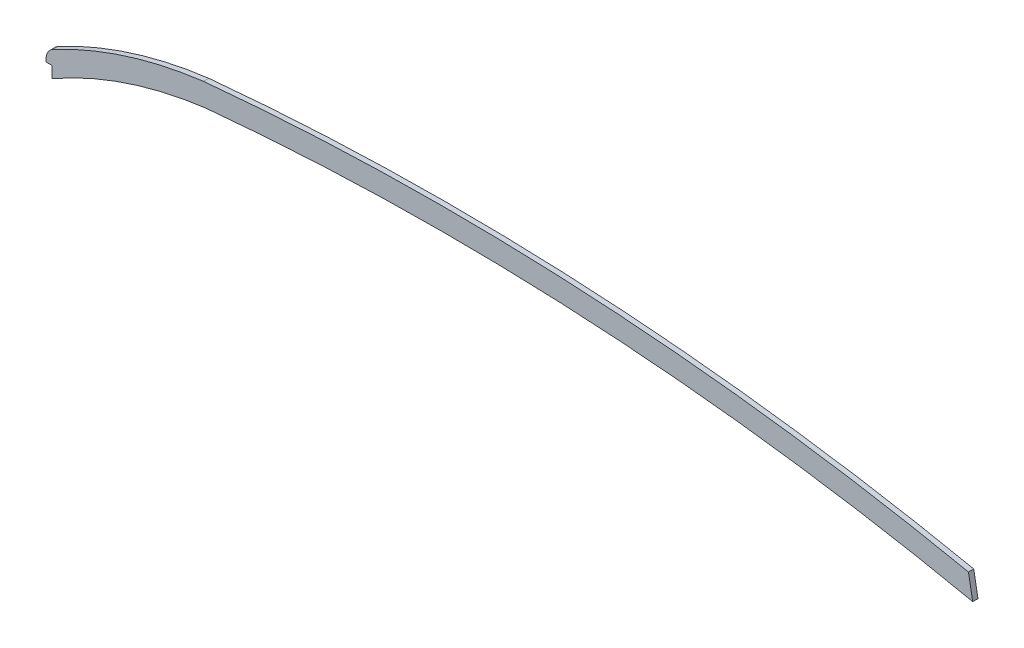
from build123d import *

# Parameters (mm, degrees)
BOSS_EXTRUDE1_DEPTH = 3.175


with BuildPart() as part:
    # Sketch1 → Boss-Extrude1 (new body)
    with BuildSketch(Plane.XY):
        with BuildLine():
            ThreePointArc((4.300521626, 108.758517405), (1.157792804, 105.775489723), (0, 101.6))
            Line((0, 101.6), (0, 100.055269774))
            Line((0, 100.055269774), (3.749926944, 100.055269774))
            Line((3.749926944, 100.055269774), (3.749926944, 93.197269774))
            ThreePointArc((3.749926944, 93.197269774), (48.49528528, 113.245962737), (96.311168805, 124.096698424))
            ThreePointArc((96.311168805, 124.096698424), (140.601076661, 127.656727127), (184.975772365, 129.92743704))
            ThreePointArc((184.975772365, 129.92743704), (230.332475218, 130.913637557), (275.698463647, 130.5528344))
            ThreePointArc((275.698463647, 130.5528344), (417.731809066, 120.678888391), (558.229469453, 97.627349478))
            Line((558.229469453, 97.627349478), (555.638244479, 111.822940798))
            ThreePointArc((555.638244479, 111.822940798), (326.208122032, 141.94293007), (94.854415026, 137.375973266))
            ThreePointArc((94.854415026, 137.375973266), (48.266347056, 127.216011607), (4.300521626, 108.758517405))
        make_face()
    extrude(amount=-BOSS_EXTRUDE1_DEPTH)


solid = part.part
